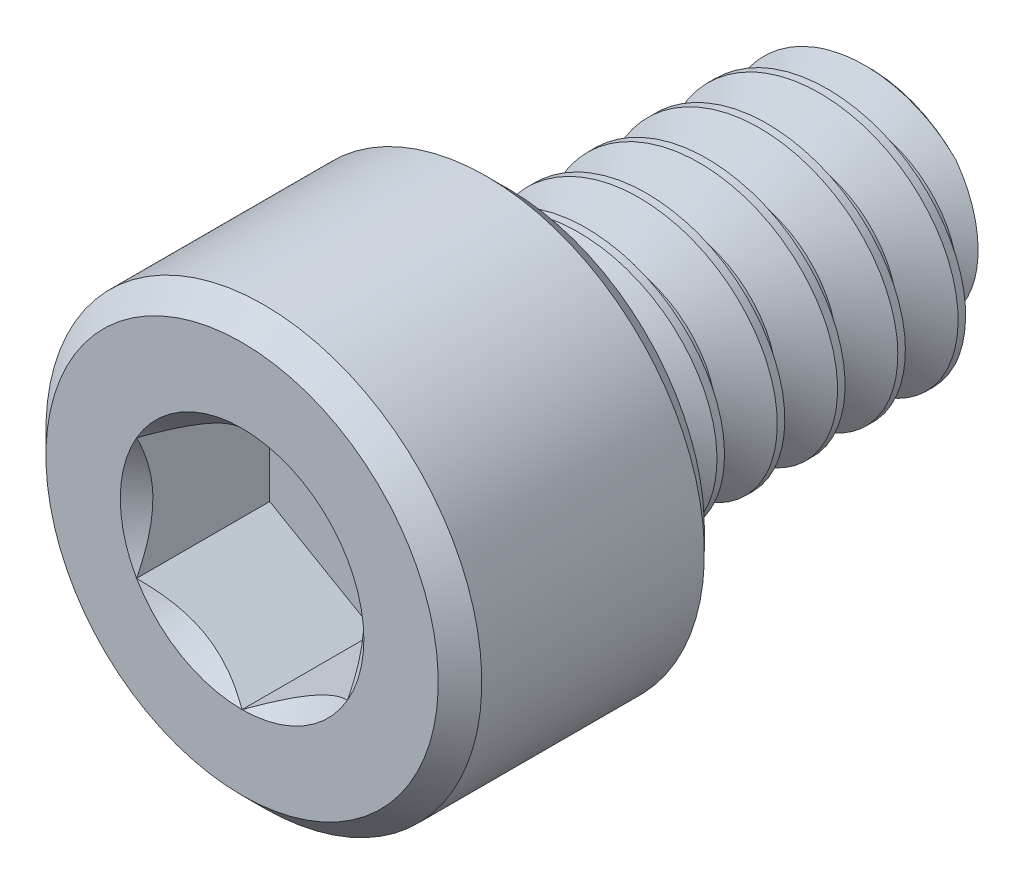
from build123d import *

# Parameters (mm, degrees)
CUT_EXTRUDE1_DEPTH = 1.7526
CUT_SWEEP1_PITCH   = 0.79375


# Read off the part's stored shape, not the designer's step: Split1
with BuildPart() as part:
    # Sketch2 → Revolve1 (revolve)
    with BuildSketch(Plane(origin=(0, 0, 0), x_dir=(0, 0, -1), z_dir=(1, 0, 0)), mode=Mode.PRIVATE) as revolve1_sk:
        Polygon((4.7625, 1.57734), (4.58724, 1.7526), (0, 1.7526), (0, 2.58318), (-0.28702, 2.8702), (-3.21818, 2.8702), (-3.5052, 2.58318), (-3.5052, 1.3890625), (-1.7526, 1.3890625), (-1.7526, 0), (4.7625, 0), align=None)
    revolve(revolve1_sk.sketch.rotate(Axis((0, 0, 1.7526), (0, 0, -1)), 180), axis=Axis((0, 0, 1.7526), (0, 0, -1)))

    # Sketch3 → Cut-Extrude1 (cut)
    with BuildSketch(Plane.XY.offset(3.5052)):
        Polygon((0, 1.603951217), (-1.3890625, 0.801975608), (-1.3890625, -0.801975608), (0, -1.603951217), (1.3890625, -0.801975608), (1.3890625, 0.801975608), align=None)
    extrude(amount=-CUT_EXTRUDE1_DEPTH, mode=Mode.SUBTRACT)

    # Cut-Extrude2 cone 1 section (through the dimple's axis) → Cut-Extrude2 (revolve, cut)
    with BuildSketch(Plane(origin=(0, 0, 3.5052), x_dir=(0, -1, 0), z_dir=(1, 0, 0))):
        Polygon((0, 0), (1.603951217, 0), (0, 1.603951217), align=None)
    revolve(axis=Axis((0, 0, 3.5052), (0, 0, -1)), mode=Mode.SUBTRACT)


with BuildPart() as body_2:
    # Split1: the piece on the far side of the plane
    add(part.part)
    split(bisect_by=Plane.XY, keep=Keep.BOTTOM)

    # Cut-Sweep1: the profile of Sketch7 screwed along a right-hand helix of 7 turns, 8 arcs to a turn; built about Z, then put on its axis
    cut_sweep1_z = Axis((0, 0, 0), (0, 0, 1))
    cut_sweep1_corners = [(1.795562979, 0, -0.719335938), (1.838525958, 0, 0.049609375), (1.237044252, 0, -0.29765625), (1.237044252, 0, -0.396875)]
    with BuildLine(mode=Mode.PRIVATE) as cut_sweep1_profile:
        Line(cut_sweep1_corners[0], cut_sweep1_corners[1])
        Line(cut_sweep1_corners[1], cut_sweep1_corners[2])
        Line(cut_sweep1_corners[2], cut_sweep1_corners[3])
        Line(cut_sweep1_corners[3], cut_sweep1_corners[0])
    cut_sweep1_cap = Face(cut_sweep1_profile.wire())
    cut_sweep1_turn_angles = [0, 22.5, 45, 67.5, 90, 112.5, 135, 157.5, 180, 202.5, 225, 247.5, 270, 292.5, 315, 337.5, 360]
    cut_sweep1_turn_weights = [1, 0.9238795325112867, 1, 0.9238795325112867, 1, 0.9238795325112867, 1, 0.9238795325112867, 1, 0.9238795325112867, 1, 0.9238795325112867, 1, 0.9238795325112867, 1, 0.9238795325112867, 1]
    cut_sweep1_turn_rails = [Edge.make_bspline([Vector(p[0], p[1], 0).rotate(cut_sweep1_z, cut_sweep1_turn_angles[k]) / cut_sweep1_turn_weights[k] + Vector(0, 0, p[2] + CUT_SWEEP1_PITCH * cut_sweep1_turn_angles[k] / 360) for k in range(17)], [0, 0, 0, 1, 1, 2, 2, 3, 3, 4, 4, 5, 5, 6, 6, 7, 7, 8, 8, 8], 2, cut_sweep1_turn_weights) for p in cut_sweep1_corners]
    cut_sweep1_turn_sides = [Face.make_surface_from_curves(cut_sweep1_turn_rails[p[0]], cut_sweep1_turn_rails[p[1]]) for p in [(0, 1), (1, 2), (2, 3), (3, 0)]]
    cut_sweep1 = Plane(origin=(0, 0, 0), x_dir=(0, 1, 0), z_dir=(0, 0, -1)) * Solid(Shell([*[p.moved(Location((0, 0, CUT_SWEEP1_PITCH * i))) for i in range(7) for p in cut_sweep1_turn_sides], cut_sweep1_cap, cut_sweep1_cap.rotate(cut_sweep1_z, 2520).moved(Location((0, 0, CUT_SWEEP1_PITCH * 2520 / 360)))]))
    add(cut_sweep1, mode=Mode.SUBTRACT)


with BuildPart() as part_1:
    add(part.part)

    # Split1
    split(bisect_by=Plane.XY, keep=Keep.TOP)

    # Combine1: union body 2
    add(body_2.part)


solid = part_1.part
